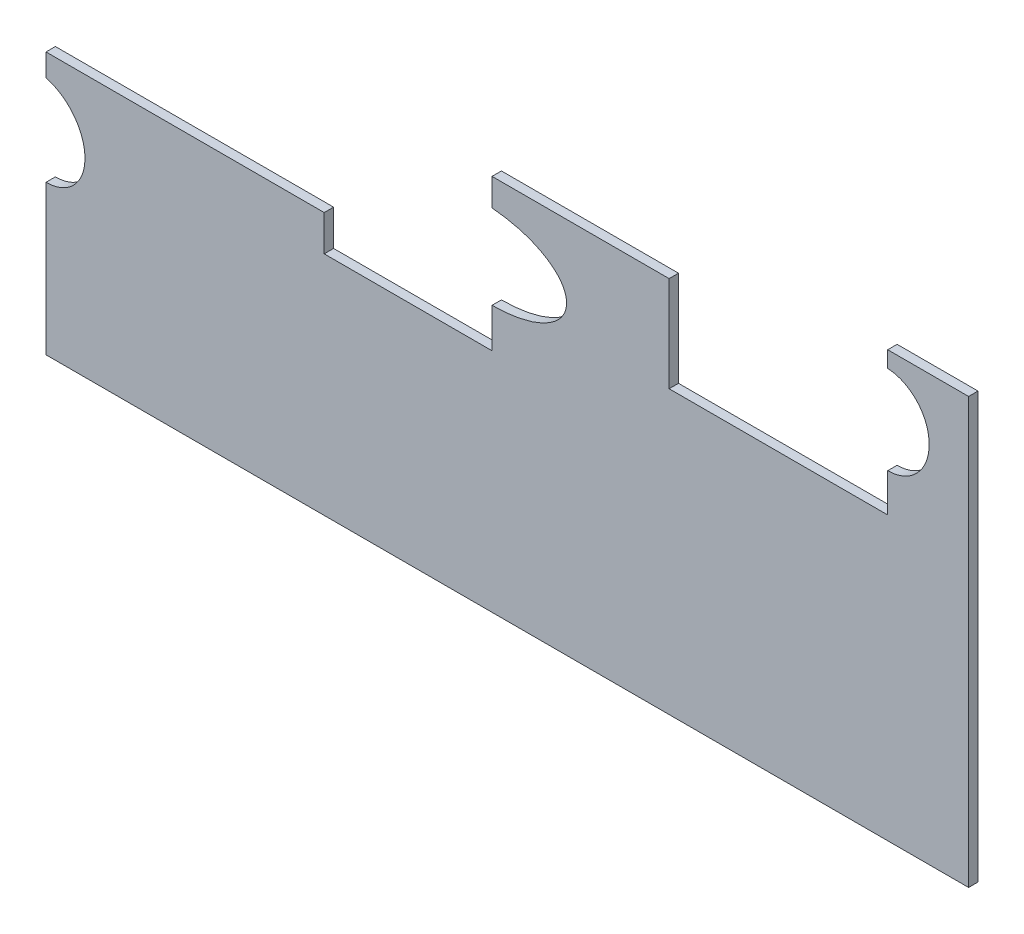
from build123d import *

# Parameters (mm, degrees)
BOSS_EXTRUDE2_OUTLINE_W = 330.2
BOSS_EXTRUDE2_OUTLINE_H = 190.5
BOSS_EXTRUDE2_DEPTH     = 3
CUT_EXTRUDE1_DEPTH      = 554.733952504


# Read off the part's stored shape, not the designer's step: Boss-Extrude2
with BuildPart() as part:
    # Boss-Extrude2 outline → Boss-Extrude2 (new body)
    with BuildSketch(Plane.XY):
        with Locations((-165.1, 349.25)):
            Rectangle(BOSS_EXTRUDE2_OUTLINE_W, BOSS_EXTRUDE2_OUTLINE_H)
        with BuildLine():
            add(Edge.make_bspline(
                [(-305.942171993, 328.501522762), (-306.170255378, 328.324665909), (-306.614042299, 327.954986533), (-307.512202671, 327.084665698), (-309.028565354, 325.224006494), (-310.814681605, 321.397067185), (-310.908770444, 315.937871104), (-309.331820466, 311.311401642), (-307.336526947, 308.049254205), (-304.674018188, 305.304468379), (-300.585989718, 302.625100143), (-295.275340887, 301.356761249), (-291.124175679, 302.133615904), (-288.944522893, 303.138863231), (-287.877956893, 303.791999802), (-287.175136962, 304.298621856), (-286.509456581, 304.853140919), (-285.611296208, 305.723461755), (-284.094933526, 307.584120959), (-282.308817275, 311.411060268), (-282.214728435, 316.870256349), (-283.791678414, 321.496725811), (-285.786971933, 324.758873247), (-288.449480692, 327.503659074), (-292.537509162, 330.18302731), (-297.848157993, 331.451366204), (-301.999323201, 330.674511549), (-304.178975987, 329.669264222), (-305.245541986, 329.01612765), (-305.714088607, 328.678379615), (-305.942171993, 328.501522762)],
                knots=[0, 0, 0, 0, 0.015625, 0.03125, 0.0625, 0.125, 0.1875, 0.21875, 0.25, 0.28125, 0.3125, 0.375, 0.4375, 0.46875, 0.484375, 0.5, 0.515625, 0.53125, 0.5625, 0.625, 0.6875, 0.71875, 0.75, 0.78125, 0.8125, 0.875, 0.9375, 0.96875, 0.984375, 1, 1, 1, 1], degree=3))
        make_face(mode=Mode.SUBTRACT)
        with BuildLine():
            add(Edge.make_bspline(
                [(-180.068905291, 353.920439433), (-180.085422965, 353.618309147), (-180.081950788, 353.012052683), (-179.905256871, 351.701966023), (-179.071932531, 349.235984489), (-176.547678646, 346.101494923), (-171.788832257, 343.101891305), (-167.066920591, 341.126264084), (-161.345782684, 339.656260684), (-155.018201929, 338.900335341), (-148.645925657, 338.961950616), (-142.798632236, 339.799499783), (-137.889488846, 341.248590487), (-132.832001497, 343.711528272), (-129.981083909, 346.552153454), (-128.883895778, 348.912592521), (-128.565435113, 350.195608733), (-128.461120803, 351.099005754), (-128.466329068, 352.008390451), (-128.643022986, 353.31847711), (-129.476347326, 355.784458645), (-132.000601211, 358.918948211), (-136.7594476, 361.918551828), (-141.481359266, 363.89417905), (-147.202497173, 365.36418245), (-153.530077928, 366.120107793), (-159.9023542, 366.058492517), (-165.74964762, 365.220943351), (-170.658791011, 363.771852646), (-175.71627836, 361.308914861), (-178.567195948, 358.468289679), (-179.664384078, 356.107850612), (-179.982844744, 354.8248344), (-180.052387617, 354.22256972), (-180.068905291, 353.920439433)],
                knots=[0, 0, 0, 0, 0.015625, 0.03125, 0.0625, 0.125, 0.15625, 0.1875, 0.21875, 0.25, 0.28125, 0.3125, 0.34375, 0.375, 0.4375, 0.46875, 0.484375, 0.5, 0.515625, 0.53125, 0.5625, 0.625, 0.65625, 0.6875, 0.71875, 0.75, 0.78125, 0.8125, 0.84375, 0.875, 0.9375, 0.96875, 0.984375, 1, 1, 1, 1], degree=3))
        make_face(mode=Mode.SUBTRACT)
        with BuildLine():
            add(Edge.make_bspline(
                [(-29.09461346, 384.409392838), (-29.375319528, 384.349132794), (-29.932845744, 384.210511135), (-31.115639474, 383.827797032), (-33.287380866, 382.853955405), (-36.5808932, 380.334793707), (-39.113343797, 375.767453995), (-39.778124595, 371.238575823), (-39.453462961, 367.698185468), (-38.296430811, 364.336482677), (-35.831427961, 360.479484886), (-31.647527324, 357.353965166), (-27.610258166, 356.408525111), (-25.230170518, 356.411838769), (-23.994513151, 356.548301078), (-23.146566065, 356.701928853), (-22.310276741, 356.909861342), (-21.127483011, 357.292575445), (-18.955741619, 358.266417073), (-15.662229285, 360.78557877), (-13.129778688, 365.352918482), (-12.46499789, 369.881796654), (-12.789659524, 373.42218701), (-13.946691674, 376.7838898), (-16.411694524, 380.640887591), (-20.595595161, 383.766407311), (-24.632864319, 384.711847366), (-27.012951967, 384.708533708), (-28.248609334, 384.572071399), (-28.813907391, 384.469652882), (-29.09461346, 384.409392838)],
                knots=[0, 0, 0, 0, 0.015625, 0.03125, 0.0625, 0.125, 0.1875, 0.21875, 0.25, 0.28125, 0.3125, 0.375, 0.4375, 0.46875, 0.484375, 0.5, 0.515625, 0.53125, 0.5625, 0.625, 0.6875, 0.71875, 0.75, 0.78125, 0.8125, 0.875, 0.9375, 0.96875, 0.984375, 1, 1, 1, 1], degree=3))
        make_face(mode=Mode.SUBTRACT)
    extrude(amount=BOSS_EXTRUDE2_DEPTH)

    # Sketch9 → Cut-Extrude1 (cut, through all)
    with BuildSketch(Plane(origin=(0, 0, 0), x_dir=(-1, 0, 0), z_dir=(0, 0, -1))):
        Polygon((330.2, 444.5), (0, 444.5), (0, 389.89), (25.851104386, 389.89), (25.851104386, 344.17), (95.701104386, 344.17), (95.701104386, 374.65), (152.287972712, 374.65), (152.287972712, 326.39), (205.910863718, 326.39), (205.910863718, 337.82), (294.810863718, 337.82), (294.810863718, 254), (330.2, 254), align=None)
    extrude(amount=-CUT_EXTRUDE1_DEPTH, mode=Mode.SUBTRACT)


solid = part.part
